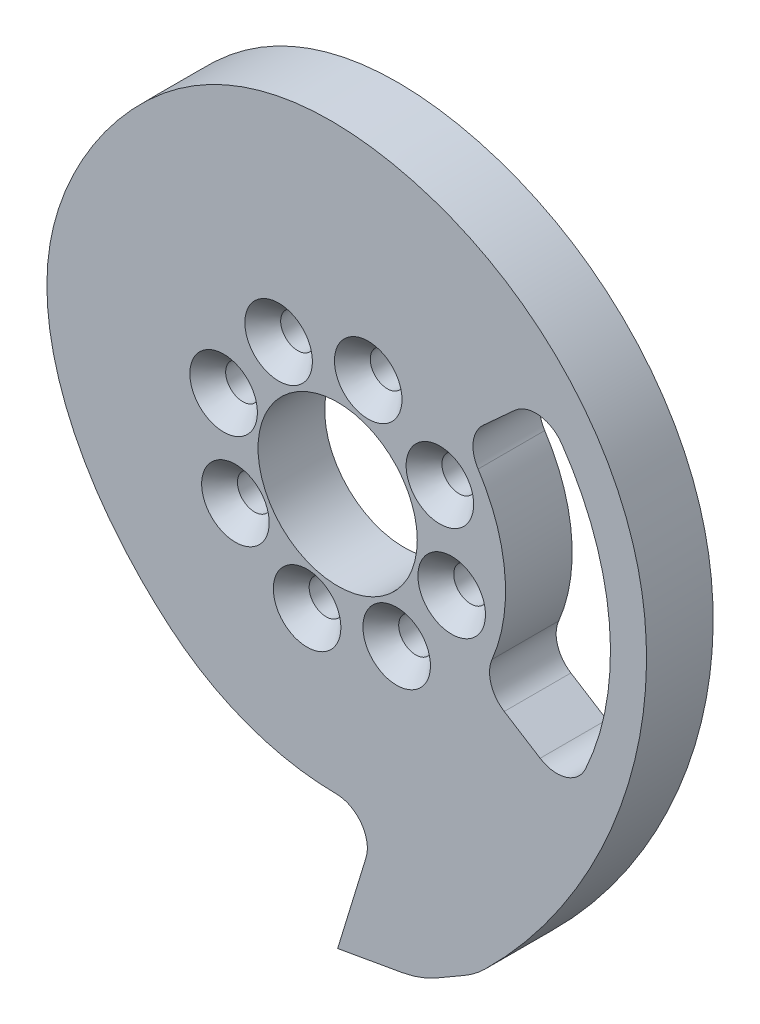
from build123d import *
from OCP.BRepFilletAPI import BRepFilletAPI_MakeFillet

# Parameters (mm, degrees)
SKETCH1_R                                        = 15.175
BOSS_EXTRUDE1_DEPTH                              = 12.7
FILLET1_R1                                       = 6
FILLET1_R2                                       = 20
CUT_EXTRUDE1_DEPTH                               = 97.187316036
FILLET2_R                                        = 6
CSK_FOR_1_4_FLAT_HEAD_MACHINE_SCREW1_D           = 6.5278
CSK_FOR_1_4_FLAT_HEAD_MACHINE_SCREW1_DEPTH       = 54.11
CSK_FOR_1_4_FLAT_HEAD_MACHINE_SCREW1_CSINK_D     = 12.8778
CSK_FOR_1_4_FLAT_HEAD_MACHINE_SCREW1_CSINK_ANGLE = 82
CSK_FOR_1_4_FLAT_HEAD_MACHINE_SCREW1_TIP         = 1.961148974


with BuildPart() as part:
    # Sketch1 → Boss-Extrude1 (new body)
    with BuildSketch(Plane.XY):
        with BuildLine():
            ThreePointArc((-31.88226544, -37.995804379), (-13.155899314, -47.823449407), (7.962221644, -48.956746486))
            Line((7.962221644, -48.956746486), (0, -75))
            Line((0, -75), (15.756924048, -72.221629157))
            Line((15.756924048, -72.221629157), (26.149228894, -66.221629157))
            add(Edge.make_bspline(
                [(26.149228894, -66.221629157), (51.375242172, -42.5711118), (73.155327324, 16.265957691), (24.786084456, 64.170295229), (-29.726149903, 61.426673461), (-65.053373901, 8.823513537), (-48.308937171, -24.212190188), (-31.88226544, -37.995804379)],
                knots=[0, 0, 0, 0, 0.320521396, 0.565793749, 0.734822836, 0.843782163, 1, 1, 1, 1], degree=3))
        make_face()
        Circle(SKETCH1_R, mode=Mode.SUBTRACT)
    extrude(amount=BOSS_EXTRUDE1_DEPTH)

    # Fillet1: one fillet with a radius per group of edges: ONE call of the kernel's fillet builder (fillet() takes one radius for all edges)
    fillet1_edges_1 = [part.edges().sort_by_distance(p)[0] for p in [
        (7.962221644, -48.956746486, 6.35),
    ]]
    fillet1_edges_2 = [part.edges().sort_by_distance(p)[0] for p in [
        (15.756924048, -72.221629157, 6.35),
        (26.149228894, -66.221629157, 6.35),
    ]]
    fillet1 = BRepFilletAPI_MakeFillet(part.part.solid().wrapped)
    for e in fillet1_edges_1:
        fillet1.Add(FILLET1_R1, e.wrapped)
    for e in fillet1_edges_2:
        fillet1.Add(FILLET1_R2, e.wrapped)
    add(Compound.cast(fillet1.Shape()), mode=Mode.REPLACE)

    # Sketch2 → Cut-Extrude1 (cut, through all)
    with BuildSketch(Plane.XY.offset(12.7)):
        with BuildLine():
            Line((38.459406213, 34.998201007), (23.6673269, 21.537354466))
            ThreePointArc((23.6673269, 21.537354466), (31.875670784, 2.818086599), (27.078868652, -17.050949314))
            Line((27.078868652, -17.050949314), (44.00316156, -27.707792636))
            ThreePointArc((44.00316156, -27.707792636), (51.797965024, 4.579390723), (38.459406213, 34.998201007))
        make_face()
    extrude(amount=-CUT_EXTRUDE1_DEPTH, mode=Mode.SUBTRACT)

    # Fillet2
    fillet2_edges = [part.edges().sort_by_distance(p)[0] for p in [
        (27.078868652, -17.050949314, 6.35),
        (38.459406213, 34.998201007, 6.35),
        (44.00316156, -27.707792636, 6.35),
        (23.6673269, 21.537354466, 6.35),
    ]]
    fillet(fillet2_edges, radius=FILLET2_R)

    # CSK for 1/4 Flat Head Machine Screw1
    with Locations(Plane.XY.offset(12.7)):
        with Locations((19.485571585, 11.25), (21.733331092, -5.823428515), (11.25, -19.485571585), (-5.823428515, -21.733331092), (-11.25, 19.485571585), (5.823428515, 21.733331092), (-19.485571585, -11.25), (-21.733331092, 5.823428515)):
            CounterSinkHole(CSK_FOR_1_4_FLAT_HEAD_MACHINE_SCREW1_D / 2, CSK_FOR_1_4_FLAT_HEAD_MACHINE_SCREW1_CSINK_D / 2, depth=CSK_FOR_1_4_FLAT_HEAD_MACHINE_SCREW1_DEPTH, counter_sink_angle=CSK_FOR_1_4_FLAT_HEAD_MACHINE_SCREW1_CSINK_ANGLE)
            with Locations((0, 0, -(CSK_FOR_1_4_FLAT_HEAD_MACHINE_SCREW1_DEPTH + CSK_FOR_1_4_FLAT_HEAD_MACHINE_SCREW1_TIP / 2))):  # 118° drill point
                Cone(0, CSK_FOR_1_4_FLAT_HEAD_MACHINE_SCREW1_D / 2, CSK_FOR_1_4_FLAT_HEAD_MACHINE_SCREW1_TIP, mode=Mode.SUBTRACT)


solid = part.part
